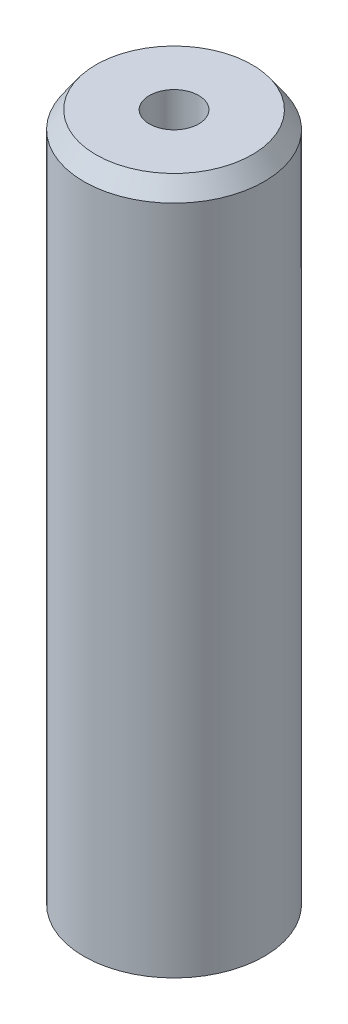
from build123d import *
from OCP.BRepFilletAPI import BRepFilletAPI_MakeChamfer

# Parameters (mm, degrees)
SKETCH1_R           = 5
BOSS_EXTRUDE1_DEPTH = 38.841700224
SKETCH2_R           = 1.369413499
CUT_EXTRUDE1_DEPTH  = 40.480092152
CHAMFER1_SIZE       = 0.953756652
CHAMFER1_SIZE2      = 0.67024406


with BuildPart() as part:
    # Sketch1 → Boss-Extrude1 (new body)
    with BuildSketch(Plane(origin=(0, 0, 0), x_dir=(1, 0, 0), z_dir=(0, 1, 0))):
        Circle(SKETCH1_R)
    extrude(amount=BOSS_EXTRUDE1_DEPTH)

    # Sketch2 → Cut-Extrude1 (cut, through all)
    with BuildSketch(Plane(origin=(0, 0, 0), x_dir=(1, 0, 0), z_dir=(0, 1, 0))):
        Circle(SKETCH2_R)
    extrude(amount=CUT_EXTRUDE1_DEPTH, mode=Mode.SUBTRACT)

    # Chamfer1: one chamfer whose edges measure the first distance from different faces: ONE call of the kernel's chamfer builder (chamfer() names one face for all edges)
    chamfer1_edges_1 = [part.edges().sort_by_distance(p)[0] for p in [
        (-5, 38.841700224, 0),
    ]]
    chamfer1_side_1 = [part.faces().sort_by_distance(p)[0] for p in [
        (-5, 19.420850112, 0),
    ]]
    chamfer1_edges_2 = [part.edges().sort_by_distance(p)[0] for p in [
        (-5, 0, 0),
    ]]
    chamfer1_side_2 = [part.faces().sort_by_distance(p)[0] for p in [
        (-4.858578644, 0, 0),
    ]]
    chamfer1 = BRepFilletAPI_MakeChamfer(part.part.solid().wrapped)
    for e in chamfer1_edges_1:
        chamfer1.Add(CHAMFER1_SIZE, CHAMFER1_SIZE2, e.wrapped, chamfer1_side_1[0].wrapped)  # the first distance lies on this face
    for e in chamfer1_edges_2:
        chamfer1.Add(CHAMFER1_SIZE, CHAMFER1_SIZE2, e.wrapped, chamfer1_side_2[0].wrapped)  # the first distance lies on this face
    add(Compound.cast(chamfer1.Shape()), mode=Mode.REPLACE)


solid = part.part
